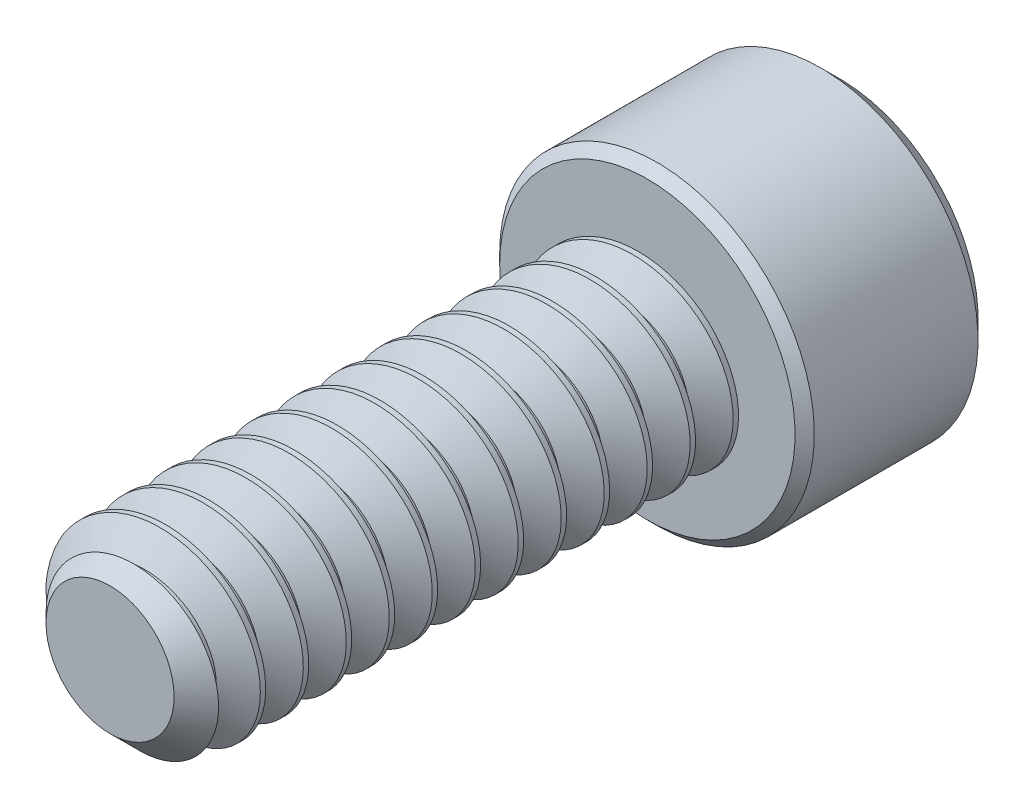
from build123d import *

# Parameters (mm, degrees)
SKETCH1_R          = 1.4224
EXTRUDE1_DEPTH     = 7.9375
CHAMFER3_SIZE      = 0.47625
CUT_SWEEP1_PITCH   = 0.635
SKETCH6_R          = 2.3241
EXTRUDE2_DEPTH     = 2.8448
CUT_EXTRUDE1_DEPTH = 1.7859375
SKETCH8_R          = 1.374815329
CUT_EXTRUDE2_DEPTH = 0.28448
CUT_EXTRUDE2_DRAFT = -45
CHAMFER1_SIZE      = 0.28448
CHAMFER2_SIZE      = 0.14224


with BuildPart() as part:
    # Sketch1 → Extrude1 (new body)
    with BuildSketch(Plane.XY):
        Circle(SKETCH1_R)
    extrude(amount=-EXTRUDE1_DEPTH)

    # Chamfer3
    chamfer3_edges = [part.edges().sort_by_distance(p)[0] for p in [
        (-1.4224, 0, 0),
    ]]
    chamfer(chamfer3_edges, length=CHAMFER3_SIZE)

    # Cut-Sweep1: the profile of Sketch3 profile screwed along a right-hand helix of 13.5 turns, 6 arcs to a turn; built about Z, then put on its axis
    cut_sweep1_z = Axis((0, 0, 0), (0, 0, 1))
    cut_sweep1_corners = [(1.4227, 0, -0.555798205), (1.009955401, 0, -0.3175), (1.009955401, 0, -0.238125), (1.4227, 0, 0.000173205)]
    with BuildLine(mode=Mode.PRIVATE) as cut_sweep1_profile:
        Line(cut_sweep1_corners[0], cut_sweep1_corners[1])
        Line(cut_sweep1_corners[1], cut_sweep1_corners[2])
        Line(cut_sweep1_corners[2], cut_sweep1_corners[3])
        Line(cut_sweep1_corners[3], cut_sweep1_corners[0])
    cut_sweep1_cap = Face(cut_sweep1_profile.wire())
    cut_sweep1_turn_angles = [0, 30, 60, 90, 120, 150, 180, 210, 240, 270, 300, 330, 360]
    cut_sweep1_turn_weights = [1, 0.8660254037844387, 1, 0.8660254037844387, 1, 0.8660254037844387, 1, 0.8660254037844387, 1, 0.8660254037844387, 1, 0.8660254037844387, 1]
    cut_sweep1_turn_rails = [Edge.make_bspline([Vector(p[0], p[1], 0).rotate(cut_sweep1_z, cut_sweep1_turn_angles[k]) / cut_sweep1_turn_weights[k] + Vector(0, 0, p[2] + CUT_SWEEP1_PITCH * cut_sweep1_turn_angles[k] / 360) for k in range(13)], [0, 0, 0, 1, 1, 2, 2, 3, 3, 4, 4, 5, 5, 6, 6, 6], 2, cut_sweep1_turn_weights) for p in cut_sweep1_corners]
    cut_sweep1_turn_sides = [Face.make_surface_from_curves(cut_sweep1_turn_rails[p[0]], cut_sweep1_turn_rails[p[1]]) for p in [(0, 1), (1, 2), (2, 3), (3, 0)]]
    cut_sweep1_last_angles = [4680, 4710, 4740, 4770, 4800, 4830, 4860]
    cut_sweep1_last_weights = [1, 0.8660254037844387, 1, 0.8660254037844387, 1, 0.8660254037843632, 1]
    cut_sweep1_last_rails = [Edge.make_bspline([Vector(p[0], p[1], 0).rotate(cut_sweep1_z, cut_sweep1_last_angles[k]) / cut_sweep1_last_weights[k] + Vector(0, 0, p[2] + CUT_SWEEP1_PITCH * cut_sweep1_last_angles[k] / 360) for k in range(7)], [0, 0, 0, 1, 1, 2, 2, 3, 3, 3], 2, cut_sweep1_last_weights) for p in cut_sweep1_corners]
    cut_sweep1_last_sides = [Face.make_surface_from_curves(cut_sweep1_last_rails[p[0]], cut_sweep1_last_rails[p[1]]) for p in [(0, 1), (1, 2), (2, 3), (3, 0)]]
    cut_sweep1 = Plane(origin=(0, 0, 0), x_dir=(0, 1, 0), z_dir=(0, 0, -1)) * Solid(Shell([*[p.moved(Location((0, 0, CUT_SWEEP1_PITCH * i))) for i in range(13) for p in cut_sweep1_turn_sides], *cut_sweep1_last_sides, cut_sweep1_cap, cut_sweep1_cap.rotate(cut_sweep1_z, 4860).moved(Location((0, 0, CUT_SWEEP1_PITCH * 4860 / 360)))]))
    add(cut_sweep1, mode=Mode.SUBTRACT)

    # Sketch6 → Extrude2 (add)
    with BuildSketch(Plane(origin=(0, 0, -7.9375), x_dir=(-1, 0, 0), z_dir=(0, 0, -1))):
        Circle(SKETCH6_R)
    extrude(amount=EXTRUDE2_DEPTH)

    # Sketch7 → Cut-Extrude1 (cut)
    with BuildSketch(Plane(origin=(0, 0, -10.7823), x_dir=(-1, 0, 0), z_dir=(0, 0, -1))):
        Polygon((0, 1.374815329), (-1.190625, 0.687407664), (-1.190625, -0.687407664), (0, -1.374815329), (1.190625, -0.687407664), (1.190625, 0.687407664), align=None)
    extrude(amount=-CUT_EXTRUDE1_DEPTH, mode=Mode.SUBTRACT)


with BuildPart() as cut_extrude2_tool:
    # Sketch8 → Cut-Extrude2 (with draft: the straight prism first)
    with BuildSketch(Plane(origin=(0, 0, -10.7823), x_dir=(-1, 0, 0), z_dir=(0, 0, -1))):
        Circle(SKETCH8_R)
    extrude(amount=-CUT_EXTRUDE2_DEPTH)
    # Cut-Extrude2: the draft: its side faces are tilted about the plane it starts from
    cut_extrude2_sides = [cut_extrude2_tool.faces().sort_by_distance(p)[0] for p in [
        (1.374815329, 0, -10.64006),
    ]]
    draft(cut_extrude2_sides, Plane(origin=(0, 0, -10.7823), x_dir=(-1, 0, 0), z_dir=(0, 0, -1)), CUT_EXTRUDE2_DRAFT)


with BuildPart() as part_1:
    add(part.part)

    # Cut-Extrude2: cut by cut_extrude2_tool
    add(cut_extrude2_tool.part, mode=Mode.SUBTRACT)

    # Chamfer1
    chamfer1_edges = [part_1.edges().sort_by_distance(p)[0] for p in [
        (2.3241, 0, -10.7823),
    ]]
    chamfer(chamfer1_edges, length=CHAMFER1_SIZE)

    # Chamfer2
    chamfer2_edges = [part_1.edges().sort_by_distance(p)[0] for p in [
        (2.3241, 0, -7.9375),
    ]]
    chamfer(chamfer2_edges, length=CHAMFER2_SIZE)


solid = part_1.part
